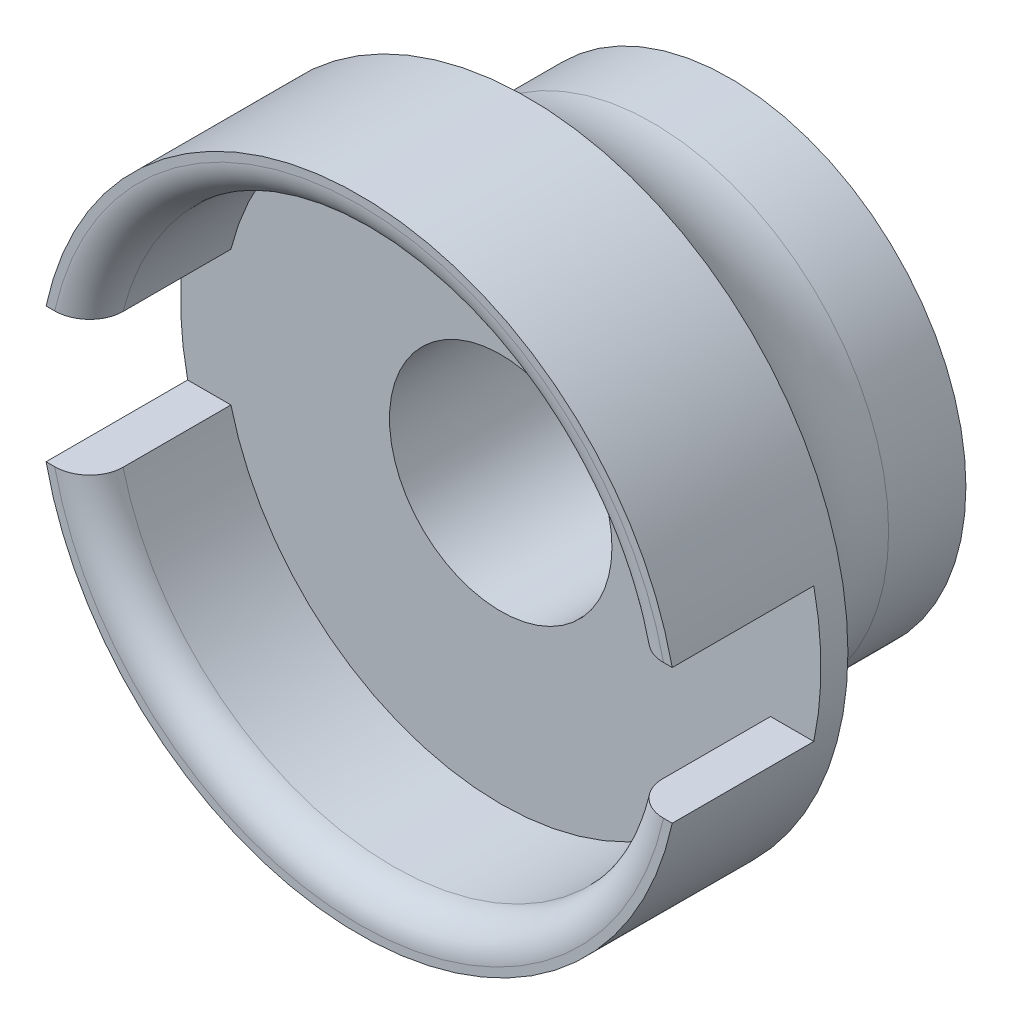
from build123d import *

# Parameters (mm, degrees)
BOSS_EXTRUDE1_DEPTH      = 1
BOSS_EXTRUDE1_DEPTH_BACK = 2
SKETCH1_R                = 3.5
SKETCH1_R_2              = 1.65
SKETCH2_R                = 4.75
BOSS_EXTRUDE2_DEPTH      = 2.5
SKETCH3_R                = 4.125
CUT_EXTRUDE1_DEPTH       = 2.1
FILLET1_R                = 0.5
SKETCH4_R                = 1.65
CUT_EXTRUDE2_DEPTH       = 10
SKETCH5_W                = 15.11331488
SKETCH5_H                = 2
CUT_EXTRUDE3_DEPTH       = 3
FILLET2_R                = 2


with BuildPart() as part:
    # Sketch1 → Boss-Extrude1 (new, two sides: drawn at the far end of the back side and taken through both)
    with BuildSketch(Plane.XY.offset(-BOSS_EXTRUDE1_DEPTH_BACK)):
        Circle(SKETCH1_R)
        Circle(SKETCH1_R_2, mode=Mode.SUBTRACT)
    extrude(amount=BOSS_EXTRUDE1_DEPTH + BOSS_EXTRUDE1_DEPTH_BACK)

    # Sketch2 → Boss-Extrude2 (add)
    with BuildSketch(Plane.XY.offset(1)):
        Circle(SKETCH2_R)
    extrude(amount=BOSS_EXTRUDE2_DEPTH)

    # Sketch3 → Cut-Extrude1 (cut)
    with BuildSketch(Plane.XY.offset(3.5)):
        Circle(SKETCH3_R)
    extrude(amount=-CUT_EXTRUDE1_DEPTH, mode=Mode.SUBTRACT)

    # Fillet1
    fillet1_edges = [part.edges().sort_by_distance(p)[0] for p in [
        (-4.125, 0, 3.5),
    ]]
    fillet(fillet1_edges, radius=FILLET1_R)

    # Sketch4 → Cut-Extrude2 (cut)
    with BuildSketch(Plane(origin=(0, 0, -2), x_dir=(-1, 0, 0), z_dir=(0, 0, -1))):
        with Locations(Location((0, 0, 0), (0, 0, 180))):
            Circle(SKETCH4_R)
    extrude(amount=-CUT_EXTRUDE2_DEPTH, mode=Mode.SUBTRACT)

    # Sketch5 → Cut-Extrude3 (cut)
    with BuildSketch(Plane.XY.offset(1.4)):
        Rectangle(SKETCH5_W, SKETCH5_H)
    extrude(amount=CUT_EXTRUDE3_DEPTH, mode=Mode.SUBTRACT)

    # Fillet2
    # the kernel refuses this fillet: 2 mm, written as the material it adds along each edge
    with BuildSketch(Plane(origin=(0, 0, 1), x_dir=(1, 0, 0), z_dir=(0, -1, 0))) as fillet2_piece_1:
        with BuildLine():
            CenterArc((5.5, -1.854049622), FILLET2_R, 112.024312837, 67.975687163)
            Line((4.75, 0), (4.735, 0.037080992))
            ThreePointArc((4.735, 0.037080992), (4.125, 0.04), (3.5, 0.04))
            Line((3.5, 0.04), (3.46, 0))
            Line((3.46, 0), (3.46, -1.854049622))
            Line((3.46, -1.854049622), (3.5, -1.854049622))
        make_face()
    revolve(axis=Axis((0, 0, 1), (0, 0, 1)))


solid = part.part
